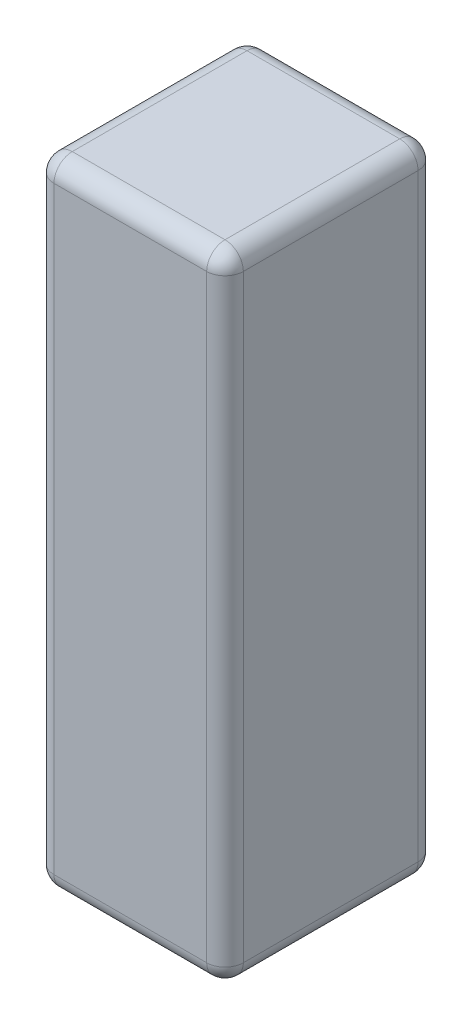
from build123d import *

# Parameters (mm, degrees)
SKETCH1_W           = 31
SKETCH1_H           = 34.6
BOSS_EXTRUDE1_DEPTH = 104
FILLET1_R           = 3


with BuildPart() as part:
    # Sketch1 → Boss-Extrude1 (new body)
    with BuildSketch(Plane(origin=(0, 0, 0), x_dir=(1, 0, 0), z_dir=(0, 1, 0))):
        with Locations((15.5, 17.3)):
            Rectangle(SKETCH1_W, SKETCH1_H)
    extrude(amount=BOSS_EXTRUDE1_DEPTH)

    # Fillet1
    fillet1_edges = [part.edges().sort_by_distance(p)[0] for p in [
        (15.5, 104, -34.6),
        (15.5, 0, -34.6),
        (0, 52, -34.6),
        (0, 104, -17.3),
        (0, 0, -17.3),
        (31, 104, -17.3),
        (31, 52, -34.6),
        (31, 0, -17.3),
        (0, 52, 0),
        (15.5, 104, 0),
        (31, 52, 0),
        (15.5, 0, 0),
    ]]
    fillet(fillet1_edges, radius=FILLET1_R)


solid = part.part
